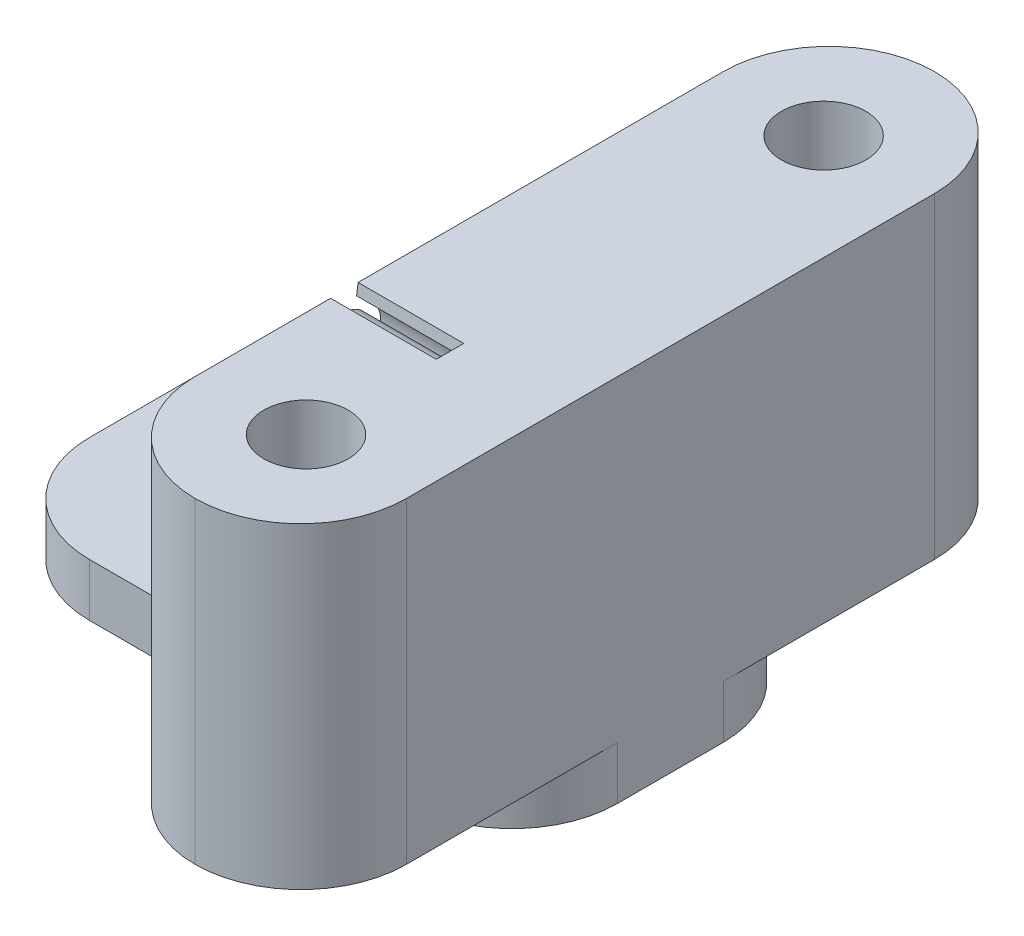
from build123d import *

# Parameters (mm, degrees)
SKETCH2_W           = 20
SKETCH2_H           = 70
BOSS_EXTRUDE1_DEPTH = 30
SKETCH3_R           = 4
CUT_EXTRUDE1_DEPTH  = 20
SKETCH4_R           = 2.5
CUT_EXTRUDE2_DEPTH  = 10
FILLET1_R           = 10
SKETCH6_W           = 50
SKETCH6_H           = 30
BOSS_EXTRUDE3_DEPTH = 5
SKETCH7_R           = 2.5
CUT_EXTRUDE3_DEPTH  = 10
FILLET3_R           = 10


with BuildPart() as part:
    # Sketch2 → Boss-Extrude1 (new body)
    with BuildSketch(Plane(origin=(0, 0, 0), x_dir=(1, 0, 0), z_dir=(0, 1, 0))):
        with Locations((6.47761194, -5.23880597)):
            Rectangle(SKETCH2_W, SKETCH2_H)
    extrude(amount=BOSS_EXTRUDE1_DEPTH)

    # Sketch3 → Cut-Extrude1 (cut)
    with BuildSketch(Plane(origin=(0, 30, 0), x_dir=(1, 0, 0), z_dir=(0, 1, 0))):
        with Locations(Location((6.47761194, 19.26119403, 0), (0, 0, 270))):
            Circle(SKETCH3_R)
        with Locations(Location((6.47761194, -29.73880597, 0), (0, 0, 270))):
            Circle(SKETCH3_R)
    extrude(amount=-CUT_EXTRUDE1_DEPTH, mode=Mode.SUBTRACT)

    # Sketch4 → Cut-Extrude2 (cut)
    with BuildSketch(Plane.ZY.offset(3.52238806)):
        with BuildLine():
            Line((17.415034126, 30.126407987), (14.795699792, 30.126407987))
            Line((14.795699792, 30.126407987), (14.949961333, 28.969446425))
            ThreePointArc((14.949961333, 28.969446425), (16.17927412, 22.186618473), (17.347611009, 28.980215007))
            Line((17.347611009, 28.980215007), (17.415034126, 30.126407987))
        make_face()
        with Locations((16.163554702, 25.686583173)):
            Circle(SKETCH4_R, mode=Mode.SUBTRACT)
    extrude(amount=-CUT_EXTRUDE2_DEPTH, mode=Mode.SUBTRACT)

    # Fillet1
    fillet1_edges = [part.edges().sort_by_distance(p)[0] for p in [
        (-3.52238806, 15, -29.76119403),
        (16.47761194, 15, -29.76119403),
        (16.47761194, 15, 40.23880597),
        (-3.52238806, 15, 40.23880597),
    ]]
    fillet(fillet1_edges, radius=FILLET1_R - 0.0001)  # a hair under: the kernel refuses the full size

    # Sketch6 → Boss-Extrude3 (add)
    with BuildSketch(Plane.XZ):
        with Locations((-8.52238806, 5.23880597)):
            Rectangle(SKETCH6_W, SKETCH6_H)
    extrude(amount=BOSS_EXTRUDE3_DEPTH)

    # Sketch7 → Cut-Extrude3 (cut)
    with BuildSketch(Plane.XZ.offset(5)):
        with Locations(Location((-13.52238806, 5.23880597, 0), (0, 0, 270))):
            Circle(SKETCH7_R)
    extrude(amount=-CUT_EXTRUDE3_DEPTH, mode=Mode.SUBTRACT)

    # Fillet3
    fillet3_edges = [part.edges().sort_by_distance(p)[0] for p in [
        (-33.52238806, -2.5, 20.23880597),
        (-33.52238806, -2.5, -9.76119403),
        (16.47761194, -2.5, -9.76119403),
        (16.47761194, -2.5, 20.23880597),
    ]]
    fillet(fillet3_edges, radius=FILLET3_R)


solid = part.part
